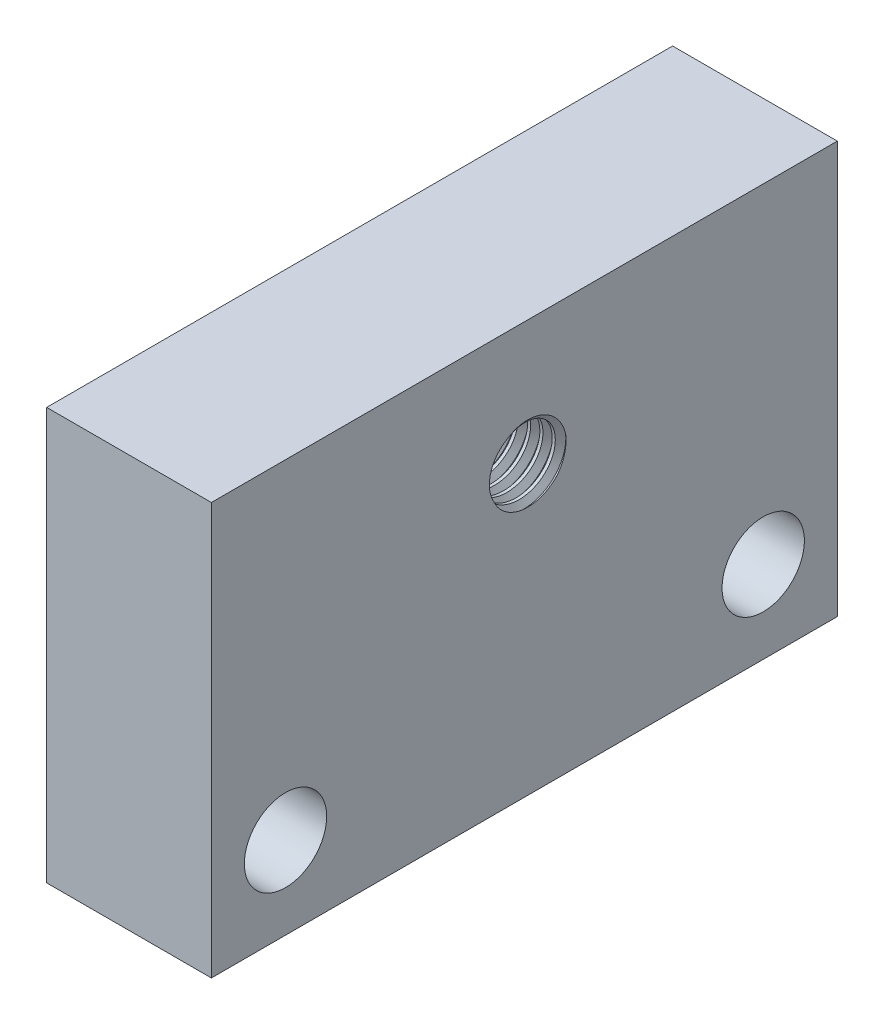
from build123d import *

# Parameters (mm, degrees)
BOSS_EXTRUDE1_DEPTH = 50
M10_TAPPED_HOLE1_D  = 8.5
THREAD1_PITCH       = 1.5000000000000002
SKETCH2_R           = 5.0000000000000036
SKETCH2_R_2         = 4.9999999999999964
CUT_EXTRUDE2_DEPTH  = 66.90902855906769


with BuildPart() as part:
    # Sketch1 → Boss-Extrude1 (new body)
    with BuildSketch(Plane(origin=(0, 0, 0), x_dir=(1, 0, 0), z_dir=(0, 1, 0))):
        Polygon((9.999999999999996, 37.99999999999999), (-10.000000000000004, 37.99999999999999), (-9.999999999999995, -38), (10.000000000000005, -38.00000000000001), align=None)
    extrude(amount=BOSS_EXTRUDE1_DEPTH)

    # M10 Tapped Hole1 (through all)
    with Locations(Plane(origin=(10.000000000000002, 0, -1.14e-15), x_dir=(-1.2e-16, 0, -1), z_dir=(1, 0, -1.2e-16))):
        with Locations((0, 35)):
            Hole(M10_TAPPED_HOLE1_D / 2)

    # Thread1: the profile of Thread Profile1 profile screwed along a right-hand helix of 13.333333 turns, 8 arcs to a turn; built about Z, then put on its axis
    thread1_z = Axis((0, 0, 0), (0, 0, 1))
    thread1_corners = [(4.2497, 0, -0.000173205), (5.061898812, 0, 0.468749998), (5.061898812, 0, 0.656249998), (4.2497, 0, 1.125173201)]
    with BuildLine(mode=Mode.PRIVATE) as thread1_profile:
        Line(thread1_corners[0], thread1_corners[1])
        Line(thread1_corners[1], thread1_corners[2])
        Line(thread1_corners[2], thread1_corners[3])
        Line(thread1_corners[3], thread1_corners[0])
    thread1_cap = Face(thread1_profile.wire())
    thread1_turn_angles = [0, 22.5, 45, 67.5, 90, 112.5, 135, 157.5, 180, 202.5, 225, 247.5, 270, 292.5, 315, 337.5, 360]
    thread1_turn_weights = [1, 0.9238795325112867, 1, 0.9238795325112867, 1, 0.9238795325112867, 1, 0.9238795325112867, 1, 0.9238795325112867, 1, 0.9238795325112867, 1, 0.9238795325112867, 1, 0.9238795325112867, 1]
    thread1_turn_rails = [Edge.make_bspline([Vector(p[0], p[1], 0).rotate(thread1_z, thread1_turn_angles[k]) / thread1_turn_weights[k] + Vector(0, 0, p[2] + THREAD1_PITCH * thread1_turn_angles[k] / 360) for k in range(17)], [0, 0, 0, 1, 1, 2, 2, 3, 3, 4, 4, 5, 5, 6, 6, 7, 7, 8, 8, 8], 2, thread1_turn_weights) for p in thread1_corners]
    thread1_turn_sides = [Face.make_surface_from_curves(thread1_turn_rails[p[0]], thread1_turn_rails[p[1]]) for p in [(0, 1), (1, 2), (2, 3), (3, 0)]]
    thread1_last_angles = [4680, 4702.5, 4725, 4747.5, 4770, 4785, 4800]
    thread1_last_weights = [1, 0.9238795325112867, 1, 0.9238795325112867, 1, 0.9659258262890703, 1]
    thread1_last_rails = [Edge.make_bspline([Vector(p[0], p[1], 0).rotate(thread1_z, thread1_last_angles[k]) / thread1_last_weights[k] + Vector(0, 0, p[2] + THREAD1_PITCH * thread1_last_angles[k] / 360) for k in range(7)], [0, 0, 0, 1, 1, 2, 2, 3, 3, 3], 2, thread1_last_weights) for p in thread1_corners]
    thread1_last_sides = [Face.make_surface_from_curves(thread1_last_rails[p[0]], thread1_last_rails[p[1]]) for p in [(0, 1), (1, 2), (2, 3), (3, 0)]]
    thread1 = Plane(origin=(-10, 35, 0), x_dir=(0, 0, -1), z_dir=(1, 0, 0)) * Solid(Shell([*[p.moved(Location((0, 0, THREAD1_PITCH * i))) for i in range(13) for p in thread1_turn_sides], *thread1_last_sides, thread1_cap, thread1_cap.rotate(thread1_z, 4800).moved(Location((0, 0, THREAD1_PITCH * 4800 / 360)))]))
    add(thread1, mode=Mode.SUBTRACT)

    # Sketch2 → Cut-Extrude2 (cut, through all)
    with BuildSketch(Plane(origin=(10.000000000000002, 0, -1.14e-15), x_dir=(-1.2e-16, 0, -1), z_dir=(1, 0, -1.2e-16))):
        with Locations((-28.999999999999996, 10.000000000000002)):
            Circle(SKETCH2_R)
        with Locations(Location((29.000000000000004, 10.000000000000009, 0), (0, 0, 180))):
            Circle(SKETCH2_R_2)
    extrude(amount=-CUT_EXTRUDE2_DEPTH, mode=Mode.SUBTRACT)


solid = part.part
